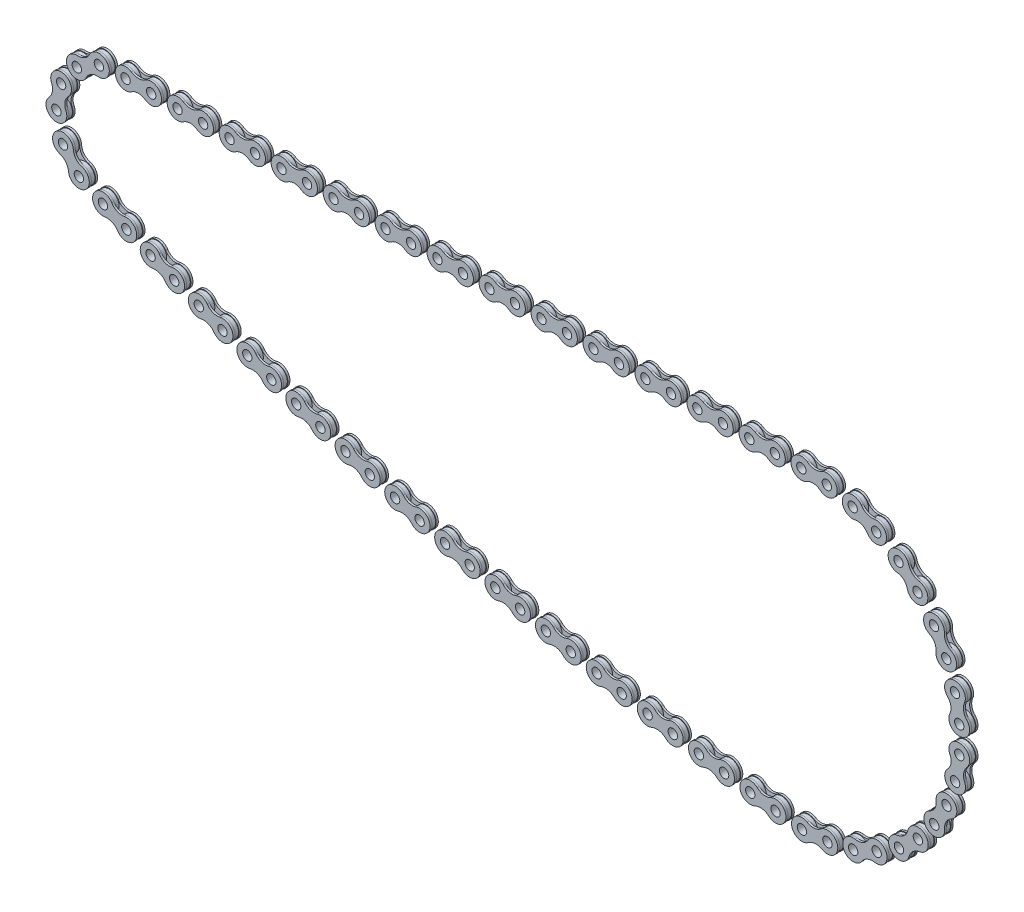
from build123d import *

# Parameters (mm, degrees)
SKETCH1_R             = 4.75
SKETCH1_R_2           = 2.25
BOSS_EXTRUDE1_DEPTH   = 1
BOSS_EXTRUDE1_2_DEPTH = 1
SKETCH3_R             = 2.25
BOSS_EXTRUDE2_DEPTH   = 1
CRVPATTERN1_5_ANGLE   = 3.8901012
CRVPATTERN1_6_ANGLE   = 23.0027709
CRVPATTERN1_7_ANGLE   = 42.1154406
CRVPATTERN1_8_ANGLE   = 61.2281103
CRVPATTERN1_9_ANGLE   = 80.34078
CRVPATTERN1_10_ANGLE  = 99.4534497
CRVPATTERN1_11_ANGLE  = 118.5661194
CRVPATTERN1_12_ANGLE  = 137.6787891
CRVPATTERN1_13_ANGLE  = 156.7914588
CRVPATTERN1_14_ANGLE  = 175.9041285
CRVPATTERN1_15_ANGLE  = 172.3357403
CRVPATTERN1_16_ANGLE  = 171.095109
CRVPATTERN1_17_ANGLE  = 169.8544777
CRVPATTERN1_18_ANGLE  = 168.6138464
CRVPATTERN1_19_ANGLE  = 167.3732151
CRVPATTERN1_20_ANGLE  = 166.1325838
CRVPATTERN1_21_ANGLE  = 164.8919525
CRVPATTERN1_22_ANGLE  = 163.6513212
CRVPATTERN1_23_ANGLE  = 162.4106898
CRVPATTERN1_24_ANGLE  = 161.1700585
CRVPATTERN1_25_ANGLE  = 159.9294272
CRVPATTERN1_26_ANGLE  = 158.6887959
CRVPATTERN1_27_ANGLE  = 157.4481646
CRVPATTERN1_28_ANGLE  = 156.2075333
CRVPATTERN1_29_ANGLE  = 128.6116148
CRVPATTERN1_30_ANGLE  = 79.3521569
CRVPATTERN1_31_ANGLE  = 30.0926989


with BuildPart() as part:
    # Sketch1 → Boss-Extrude1 (new, symmetric)
    with BuildSketch(Plane.XY):
        with Locations((-6.15, 0)):
            Circle(SKETCH1_R)
        with Locations((-6.15, 0)):
            Circle(SKETCH1_R_2, mode=Mode.SUBTRACT)
    extrude(amount=BOSS_EXTRUDE1_DEPTH, both=True)



with BuildPart() as body_2:
    # Sketch1 → Boss-Extrude1 2 (new, symmetric)
    with BuildSketch(Plane.XY):
        with Locations(Location((6.15, 0, 0), (0, 0, 180))):
            Circle(SKETCH1_R)
        with Locations((6.15, 0)):
            Circle(SKETCH1_R_2, mode=Mode.SUBTRACT)
    extrude(amount=BOSS_EXTRUDE1_2_DEPTH, both=True)


with BuildPart() as part_1:
    add(part.part)

    add(body_2.part)  # Boss-Extrude2 merges body 2
    # Sketch3 → Boss-Extrude2 (add)
    with BuildSketch(Plane.XY.offset(1)):
        with BuildLine():
            ThreePointArc((-3.409587655, 4.182121493), (-11.149181322, -0.090477137), (-3.260052552, -4.080221041))
            ThreePointArc((-3.260052552, -4.080221041), (0, -3.042649322), (3.260052552, -4.080221041))
            ThreePointArc((3.260052552, -4.080221041), (11.149181322, -0.090477137), (3.409587655, 4.182121493))
            ThreePointArc((3.409587655, 4.182121493), (0, 3.164527018), (-3.409587655, 4.182121493))
        make_face()
        with Locations((6.15, 0)):
            Circle(SKETCH3_R, mode=Mode.SUBTRACT)
        with Locations((-6.15, 0)):
            Circle(SKETCH3_R, mode=Mode.SUBTRACT)
    extrude(amount=BOSS_EXTRUDE2_DEPTH)

    # Mirror1: part across plane


with BuildPart() as part_2:
    add(part_1.part)
    add(part_1.part.mirror(Plane.XY))


with BuildPart() as body_2_2:
    # CrvPattern1: read off the stored shape, not the designer's step
    # CrvPattern1: copy of part
    add(part_2.part.moved(Location((25.0184261, 0, 0))))


with BuildPart() as body_3:
    # CrvPattern1 2: copy of part
    add(part_2.part.moved(Location((50.0368522, 0, 0))))


with BuildPart() as body_4:
    # CrvPattern1 3: copy of part
    add(part_2.part.moved(Location((75.0552784, 0, 0))))


with BuildPart() as body_5:
    # CrvPattern1 4: copy of part
    add(part_2.part.moved(Location((100.0737045, 0, 0))))


with BuildPart() as body_6:
    # CrvPattern1 5: copy of part
    add(part_2.part.moved(Location((124.8109731, 8.3139237, 0))).rotate(Axis((0, 0, 0), (0, 0, -1)), CRVPATTERN1_5_ANGLE))


with BuildPart() as body_7:
    # CrvPattern1 6: copy of part
    add(part_2.part.moved(Location((139.7620647, 52.8557307, 0))).rotate(Axis((0, 0, 0), (0, 0, -1)), CRVPATTERN1_6_ANGLE))


with BuildPart() as body_8:
    # CrvPattern1 7: copy of part
    add(part_2.part.moved(Location((139.3048169, 99.8376276, 0))).rotate(Axis((0, 0, 0), (0, 0, -1)), CRVPATTERN1_7_ANGLE))


with BuildPart() as body_9:
    # CrvPattern1 8: copy of part
    add(part_2.part.moved(Location((123.4896398, 144.0800042, 0))).rotate(Axis((0, 0, 0), (0, 0, -1)), CRVPATTERN1_8_ANGLE))


with BuildPart() as body_10:
    # CrvPattern1 9: copy of part
    add(part_2.part.moved(Location((94.0601084, 180.705274, 0))).rotate(Axis((0, 0, 0), (0, 0, -1)), CRVPATTERN1_9_ANGLE))


with BuildPart() as body_11:
    # CrvPattern1 10: copy of part
    add(part_2.part.moved(Location((54.2607383, 205.6756134, 0))).rotate(Axis((0, 0, 0), (0, 0, -1)), CRVPATTERN1_10_ANGLE))


with BuildPart() as body_12:
    # CrvPattern1 11: copy of part
    add(part_2.part.moved(Location((8.479288, 216.2381188, 0))).rotate(Axis((0, 0, 0), (0, 0, -1)), CRVPATTERN1_11_ANGLE))


with BuildPart() as body_13:
    # CrvPattern1 12: copy of part
    add(part_2.part.moved(Location((-38.2369778, 211.2283064, 0))).rotate(Axis((0, 0, 0), (0, 0, -1)), CRVPATTERN1_12_ANGLE))


with BuildPart() as body_14:
    # CrvPattern1 13: copy of part
    add(part_2.part.moved(Location((-80.737734, 191.1984927, 0))).rotate(Axis((0, 0, 0), (0, 0, -1)), CRVPATTERN1_13_ANGLE))


with BuildPart() as body_15:
    # CrvPattern1 14: copy of part
    add(part_2.part.moved(Location((-114.3374024, 158.3569033, 0))).rotate(Axis((0, 0, 0), (0, 0, -1)), CRVPATTERN1_14_ANGLE))


with BuildPart() as body_16:
    # CrvPattern1 15: copy of part
    add(part_2.part.moved(Location((-119.3047574, 133.3461633, 0))).rotate(Axis((0, 0, 0), (0, 0, 1)), CRVPATTERN1_15_ANGLE))


with BuildPart() as body_17:
    # CrvPattern1 16: copy of part
    add(part_2.part.moved(Location((-97.1476963, 131.0026383, 0))).rotate(Axis((0, 0, 0), (0, 0, 1)), CRVPATTERN1_16_ANGLE))


with BuildPart() as body_18:
    # CrvPattern1 17: copy of part
    add(part_2.part.moved(Location((-74.9450887, 129.1393943, 0))).rotate(Axis((0, 0, 0), (0, 0, 1)), CRVPATTERN1_17_ANGLE))


with BuildPart() as body_19:
    # CrvPattern1 18: copy of part
    add(part_2.part.moved(Location((-52.7073439, 127.7573048, 0))).rotate(Axis((0, 0, 0), (0, 0, 1)), CRVPATTERN1_18_ANGLE))


with BuildPart() as body_20:
    # CrvPattern1 19: copy of part
    add(part_2.part.moved(Location((-30.4448879, 126.8570177, 0))).rotate(Axis((0, 0, 0), (0, 0, 1)), CRVPATTERN1_19_ANGLE))


with BuildPart() as body_21:
    # CrvPattern1 20: copy of part
    add(part_2.part.moved(Location((-8.1681581, 126.4389553, 0))).rotate(Axis((0, 0, 0), (0, 0, 1)), CRVPATTERN1_20_ANGLE))


with BuildPart() as body_22:
    # CrvPattern1 21: copy of part
    add(part_2.part.moved(Location((14.1124012, 126.5033135, 0))).rotate(Axis((0, 0, 0), (0, 0, 1)), CRVPATTERN1_21_ANGLE))


with BuildPart() as body_23:
    # CrvPattern1 22: copy of part
    add(part_2.part.moved(Location((36.386344, 127.0500621, 0))).rotate(Axis((0, 0, 0), (0, 0, 1)), CRVPATTERN1_22_ANGLE))


with BuildPart() as body_24:
    # CrvPattern1 23: copy of part
    add(part_2.part.moved(Location((58.6432276, 128.0789447, 0))).rotate(Axis((0, 0, 0), (0, 0, 1)), CRVPATTERN1_23_ANGLE))


with BuildPart() as body_25:
    # CrvPattern1 24: copy of part
    add(part_2.part.moved(Location((80.8726169, 129.5894791, 0))).rotate(Axis((0, 0, 0), (0, 0, 1)), CRVPATTERN1_24_ANGLE))


with BuildPart() as body_26:
    # CrvPattern1 25: copy of part
    add(part_2.part.moved(Location((103.0640901, 131.580957, 0))).rotate(Axis((0, 0, 0), (0, 0, 1)), CRVPATTERN1_25_ANGLE))


with BuildPart() as body_27:
    # CrvPattern1 26: copy of part
    add(part_2.part.moved(Location((125.2072428, 134.0524447, 0))).rotate(Axis((0, 0, 0), (0, 0, 1)), CRVPATTERN1_26_ANGLE))


with BuildPart() as body_28:
    # CrvPattern1 27: copy of part
    add(part_2.part.moved(Location((147.2916935, 137.0027834, 0))).rotate(Axis((0, 0, 0), (0, 0, 1)), CRVPATTERN1_27_ANGLE))


with BuildPart() as body_29:
    # CrvPattern1 28: copy of part
    add(part_2.part.moved(Location((169.3070883, 140.4305901, 0))).rotate(Axis((0, 0, 0), (0, 0, 1)), CRVPATTERN1_28_ANGLE))


with BuildPart() as body_30:
    # CrvPattern1 29: copy of part
    add(part_2.part.moved(Location((108.2446447, 211.2416783, 0))).rotate(Axis((0, 0, 0), (0, 0, 1)), CRVPATTERN1_29_ANGLE))


with BuildPart() as body_31:
    # CrvPattern1 30: copy of part
    add(part_2.part.moved(Location((-67.3681485, 229.9820609, 0))).rotate(Axis((0, 0, 0), (0, 0, 1)), CRVPATTERN1_30_ANGLE))


with BuildPart() as body_32:
    # CrvPattern1 31: copy of part
    add(part_2.part.moved(Location((-196.1782262, 109.1556607, 0))).rotate(Axis((0, 0, 0), (0, 0, 1)), CRVPATTERN1_31_ANGLE))


with BuildPart() as body_33:
    # CrvPattern1 32: copy of part
    add(part_2.part.moved(Location((-200.147409, 0, 0))))


with BuildPart() as body_34:
    # CrvPattern1 33: copy of part
    add(part_2.part.moved(Location((-175.1289829, 0, 0))))


with BuildPart() as body_35:
    # CrvPattern1 34: copy of part
    add(part_2.part.moved(Location((-150.1105567, 0, 0))))


with BuildPart() as body_36:
    # CrvPattern1 35: copy of part
    add(part_2.part.moved(Location((-125.0921306, 0, 0))))


with BuildPart() as body_37:
    # CrvPattern1 36: copy of part
    add(part_2.part.moved(Location((-100.0737045, 0, 0))))


with BuildPart() as body_38:
    # CrvPattern1 37: copy of part
    add(part_2.part.moved(Location((-75.0552784, 0, 0))))


with BuildPart() as body_39:
    # CrvPattern1 38: copy of part
    add(part_2.part.moved(Location((-50.0368522, 0, 0))))


with BuildPart() as body_40:
    # CrvPattern1 39: copy of part
    add(part_2.part.moved(Location((-25.0184261, 0, 0))))


solid = Compound([part_2.part, body_2_2.part, body_3.part, body_4.part, body_5.part, body_6.part, body_7.part, body_8.part, body_9.part, body_10.part, body_11.part, body_12.part, body_13.part, body_14.part, body_15.part, body_16.part, body_17.part, body_18.part, body_19.part, body_20.part, body_21.part, body_22.part, body_23.part, body_24.part, body_25.part, body_26.part, body_27.part, body_28.part, body_29.part, body_30.part, body_31.part, body_32.part, body_33.part, body_34.part, body_35.part, body_36.part, body_37.part, body_38.part, body_39.part, body_40.part])
